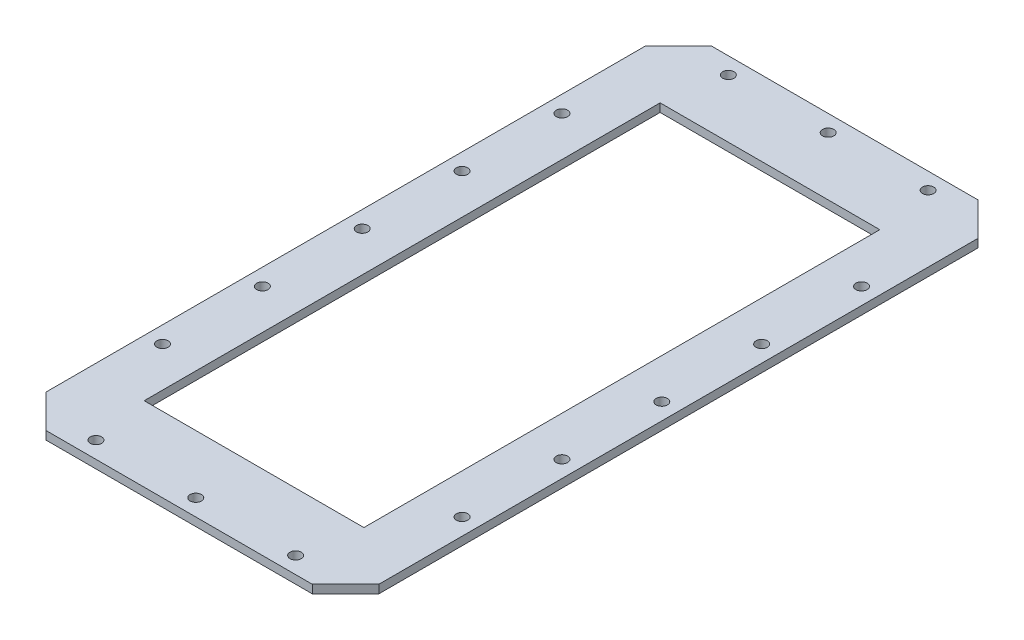
from build123d import *

# Parameters (mm, degrees)
SKETCH2_R           = 2.159
SKETCH2_W           = 83.82
SKETCH2_H           = 196.85
BOSS_EXTRUDE1_DEPTH = 3.175


with BuildPart() as part:
    # Sketch2 → Boss-Extrude1 (new body)
    with BuildSketch(Plane(origin=(0, 0, 0), x_dir=(1, 0, 0), z_dir=(0, 1, 0))):
        Polygon((0, 241.3), (0, 12.7), (12.7, 0), (114.3, 0), (127, 12.7), (127, 241.3), (114.3, 254), (12.7, 254), align=None)
        with Locations((25.4, 6.35)):
            Circle(SKETCH2_R, mode=Mode.SUBTRACT)
        with Locations((6.35, 50.8)):
            Circle(SKETCH2_R, mode=Mode.SUBTRACT)
        with Locations((63.5, 6.35)):
            Circle(SKETCH2_R, mode=Mode.SUBTRACT)
        with Locations((6.35, 88.9)):
            Circle(SKETCH2_R, mode=Mode.SUBTRACT)
        with Locations((101.6, 6.35)):
            Circle(SKETCH2_R, mode=Mode.SUBTRACT)
        with Locations((120.65, 50.8)):
            Circle(SKETCH2_R, mode=Mode.SUBTRACT)
        with Locations((120.65, 88.9)):
            Circle(SKETCH2_R, mode=Mode.SUBTRACT)
        with Locations((6.35, 127)):
            Circle(SKETCH2_R, mode=Mode.SUBTRACT)
        with Locations((6.35, 165.1)):
            Circle(SKETCH2_R, mode=Mode.SUBTRACT)
        with Locations((63.5, 127)):
            Rectangle(SKETCH2_W, SKETCH2_H, mode=Mode.SUBTRACT)
        with Locations((6.35, 203.2)):
            Circle(SKETCH2_R, mode=Mode.SUBTRACT)
        with Locations((25.4, 247.65)):
            Circle(SKETCH2_R, mode=Mode.SUBTRACT)
        with Locations((63.5, 247.65)):
            Circle(SKETCH2_R, mode=Mode.SUBTRACT)
        with Locations((120.65, 127)):
            Circle(SKETCH2_R, mode=Mode.SUBTRACT)
        with Locations((120.65, 165.1)):
            Circle(SKETCH2_R, mode=Mode.SUBTRACT)
        with Locations((120.65, 203.2)):
            Circle(SKETCH2_R, mode=Mode.SUBTRACT)
        with Locations((101.6, 247.65)):
            Circle(SKETCH2_R, mode=Mode.SUBTRACT)
    extrude(amount=BOSS_EXTRUDE1_DEPTH)


solid = part.part
